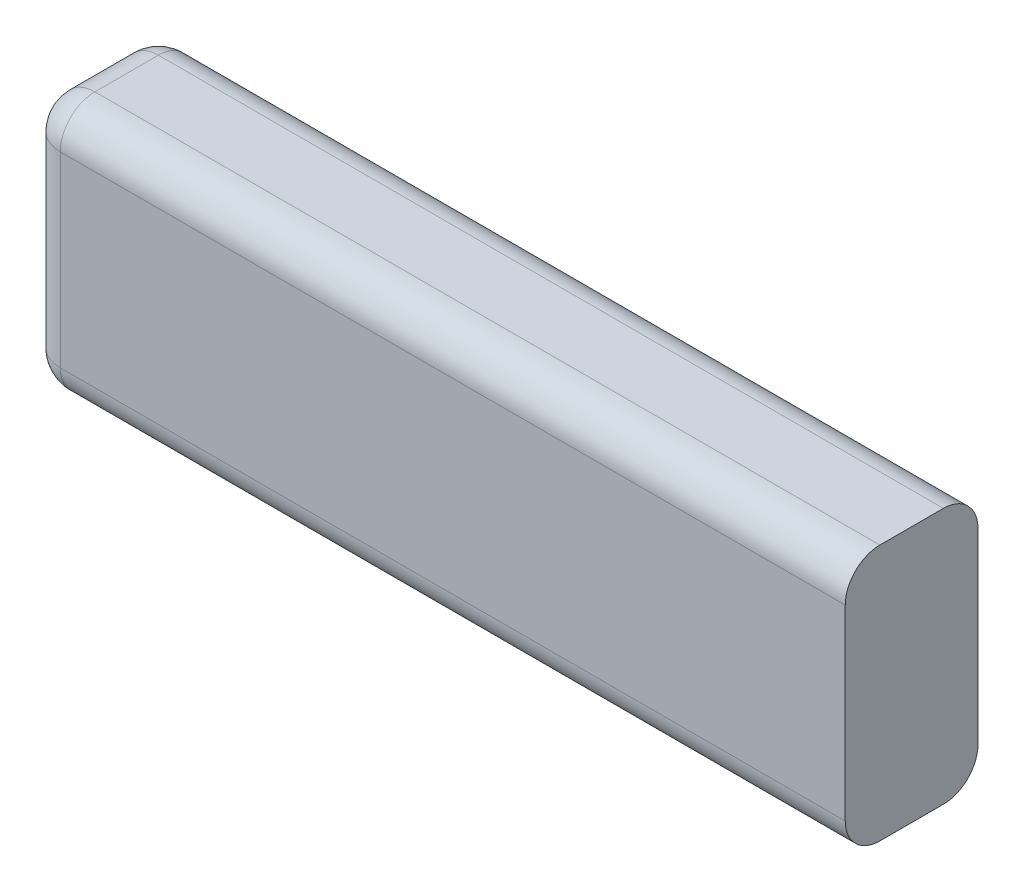
from build123d import *

# Parameters (mm, degrees)
SKETCH1_W           = 35.5
SKETCH1_H           = 11.1
BOSS_EXTRUDE1_DEPTH = 5.75
FILLET1_R           = 1.5


with BuildPart() as part:
    # Sketch1 → Boss-Extrude1 (new body)
    with BuildSketch(Plane.XY):
        with Locations((17.75, 5.55)):
            Rectangle(SKETCH1_W, SKETCH1_H)
    extrude(amount=BOSS_EXTRUDE1_DEPTH)

    # Fillet1
    fillet1_edges = [part.edges().sort_by_distance(p)[0] for p in [
        (17.75, 0, 0),
        (17.75, 0, 5.75),
        (0, 0, 2.875),
        (0, 5.55, 0),
        (0, 5.55, 5.75),
        (17.75, 11.1, 0),
        (17.75, 11.1, 5.75),
        (0, 11.1, 2.875),
    ]]
    fillet(fillet1_edges, radius=FILLET1_R)


solid = part.part
